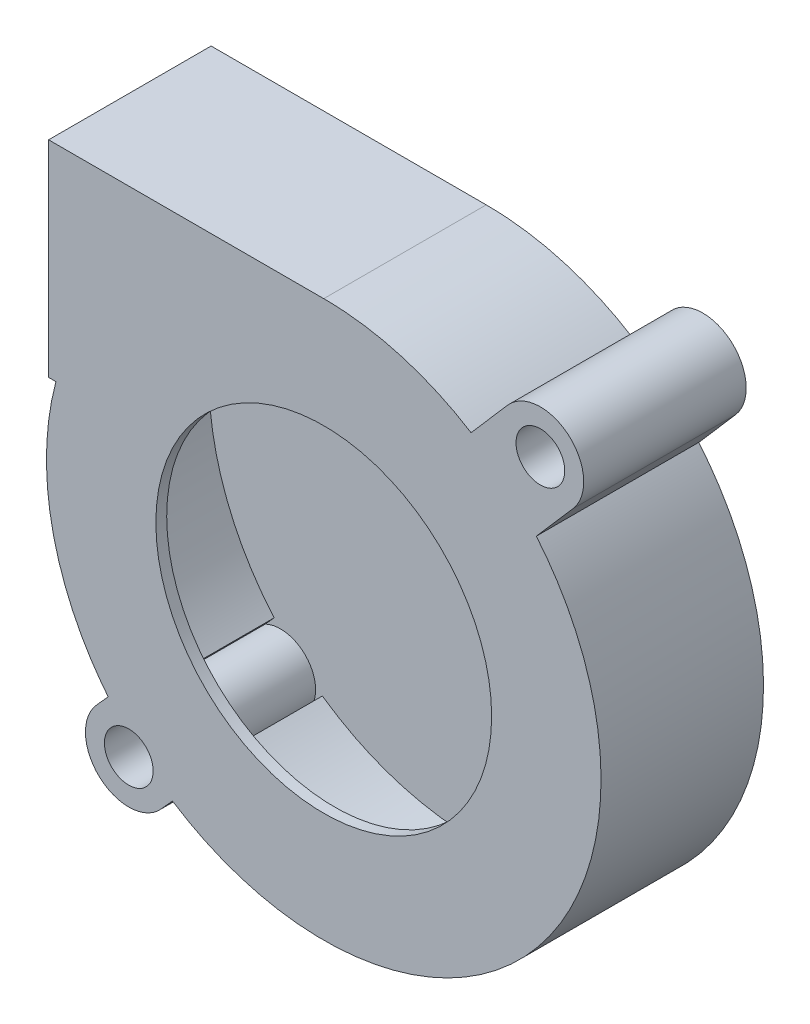
from build123d import *

# Parameters (mm, degrees)
ESBO_O1_R                = 2.25
RESSALTO_EXTRUS_O1_DEPTH = 15
CASCA1_START             = 1
CASCA1_DEPTH             = 13
ESBO_O2_R                = 15.5
CORTE_EXTRUS_O1_DEPTH    = 5


# Read off the part's stored shape, not the designer's step: Casca1
with BuildPart() as part:
    # Esboço1 → Ressalto-extrusão1 (new body)
    with BuildSketch(Plane.XY):
        with BuildLine():
            Line((-25.4, 25.65), (-25.4, 6.65))
            Line((-25.4, 6.65), (-24.724678752, 6.65))
            add(Edge.make_bspline(
                [(-24.724678752, 6.65), (-28.106558561, -5.97298277), (-19.901735966, -16.133651497)],
                knots=[1.308541168, 1.308541168, 1.308541168, 2.251052583, 2.251052583, 2.251052583], degree=2, weights=[1, 0.890998893, 1]))
            Line((-19.901735966, -16.133651497), (-20.973176585, -17.324141074))
            ThreePointArc((-20.973176585, -17.324141074), (-20.675858926, -22.973176585), (-15.026823415, -22.675858926))
            Line((-15.026823415, -22.675858926), (-13.965769598, -21.496910241))
            add(Edge.make_bspline(
                [(-13.965769598, -21.496910241), (4.523541683, -33.555718016), (19.157336075, -17.014228369), (33.791130467, -0.472738722), (19.62398008, 16.47167683)],
                knots=[2.564561883, 2.564561883, 2.564561883, 3.987138718, 3.987138718, 5.409715552, 5.409715552, 5.409715552], degree=2, weights=[1, 0.757521413, 1, 0.757521413, 1]))
            Line((19.62398008, 16.47167683), (23.018422089, 20.37528514))
            ThreePointArc((23.018422089, 20.37528514), (22.62471486, 26.018422089), (16.981577911, 25.62471486))
            Line((16.981577911, 25.62471486), (13.597282201, 21.732774793))
            add(Edge.make_bspline(
                [(13.597282201, 21.732774793), (7.360697848, 25.65), (0, 25.65)],
                knots=[5.723235305, 5.723235305, 5.723235305, 6.283185307, 6.283185307, 6.283185307], degree=2, weights=[1, 0.961062347, 1]))
            Line((0, 25.65), (-25.4, 25.65))
        make_face()
        with Locations((20, 23)):
            Circle(ESBO_O1_R, mode=Mode.SUBTRACT)
        with Locations((-18, -20)):
            Circle(ESBO_O1_R, mode=Mode.SUBTRACT)
    extrude(amount=RESSALTO_EXTRUS_O1_DEPTH)

    # Casca1 outline → Casca1 (cut)
    with BuildSketch(Plane.XY.offset(CASCA1_START)):
        with BuildLine():
            Line((-25.4, 7.65), (-23.385351535, 7.64999969))
            add(Edge.make_bspline(
                [(-23.385351535, 7.64999969), (-24.17199858, 5.235506394), (-24.682785583, 2.730743349), (-24.90609995, 0.171320102), (-24.835563034, -2.40543645), (-24.470326841, -4.961384554), (-23.815184048, -7.458532577), (-22.880474153, -9.860017351), (-21.681786393, -12.131040593), (-20.239482225, -14.239711997), (-18.578072326, -16.157761655)],
                knots=[1.255263913, 1.255263913, 1.255263913, 1.255263913, 1.255263913, 1.255263913, 1.255263913, 1.255263913, 1.255263913, 1.255263913, 1.255263913, 2.285584789, 2.285584789, 2.285584789, 2.285584789, 2.285584789, 2.285584789, 2.285584789, 2.285584789, 2.285584789, 2.285584789, 2.285584789], degree=10))
            Line((-18.578072326, -16.157761655), (-19.393676524, -17.063988122))
            ThreePointArc((-19.393676524, -17.063988122), (-15.825864622, -17.584294025), (-14.933911647, -21.077776512))
            Line((-14.933911647, -21.077776512), (-14.126414033, -20.180556662))
            add(Edge.make_bspline(
                [(-14.126414033, -20.180556662), (-12.894469623, -21.046428231), (-11.603806513, -21.828389491), (-10.260828352, -22.521943984), (-8.872330206, -23.123156203), (-7.44544143, -23.628691319), (-5.987563773, -24.035847871), (-4.506305803, -24.342582745), (-3.00941483, -24.547528063), (-1.504707502, -24.65), (5.664084267, -24.65), (11.328166069, -23.198021508), (16.57534964, -20.293987445), (20.988645613, -16.075406322), (24.203725763, -10.816450247), (25.96055219, -4.905429485), (26.143835683, 1.204523652), (24.793206453, 7.057538799), (22.085649236, 12.250706768), (18.300101207, 16.473191598)],
                knots=[2.52987437, 2.52987437, 2.52987437, 2.52987437, 2.52987437, 2.52987437, 2.52987437, 2.52987437, 2.52987437, 2.52987437, 2.52987437, 3.141592654, 3.141592654, 3.141592654, 3.141592654, 3.141592654, 3.141592654, 3.141592654, 3.141592654, 3.141592654, 5.444248753, 5.444248753, 5.444248753, 5.444248753, 5.444248753, 5.444248753, 5.444248753, 5.444248753, 5.444248753, 5.444248753, 5.444248753], degree=10))
            Line((18.300101207, 16.473191598), (21.443593173, 20.088206953))
            ThreePointArc((21.443593173, 20.088206953), (17.867419176, 20.547532053), (16.91596004, 24.025279242))
            Line((16.91596004, 24.025279242), (13.780387001, 20.419369912))
            add(Edge.make_bspline(
                [(13.780387001, 20.419369912), (12.568672482, 21.240445194), (11.302832238, 21.981293158), (9.988817758, 22.637884882), (8.632921434, 23.206698186), (7.241726405, 23.684751259), (5.822052479, 24.069630284), (4.380899042, 24.359510529), (2.9253859, 24.553170619), (1.462693032, 24.65), (0, 24.65)],
                knots=[5.688547432, 5.688547432, 5.688547432, 5.688547432, 5.688547432, 5.688547432, 5.688547432, 5.688547432, 5.688547432, 5.688547432, 5.688547432, 6.283185307, 6.283185307, 6.283185307, 6.283185307, 6.283185307, 6.283185307, 6.283185307, 6.283185307, 6.283185307, 6.283185307, 6.283185307], degree=10))
            Line((0, 24.65), (-25.4, 24.65))
            Line((-25.4, 24.65), (-25.4, 7.65))
        make_face()
    extrude(amount=CASCA1_DEPTH, mode=Mode.SUBTRACT)

    # Esboço2 → Corte-extrusão1 (cut)
    with BuildSketch(Plane.XY.offset(15)):
        Circle(ESBO_O2_R)
    extrude(amount=-CORTE_EXTRUS_O1_DEPTH, mode=Mode.SUBTRACT)


solid = part.part
